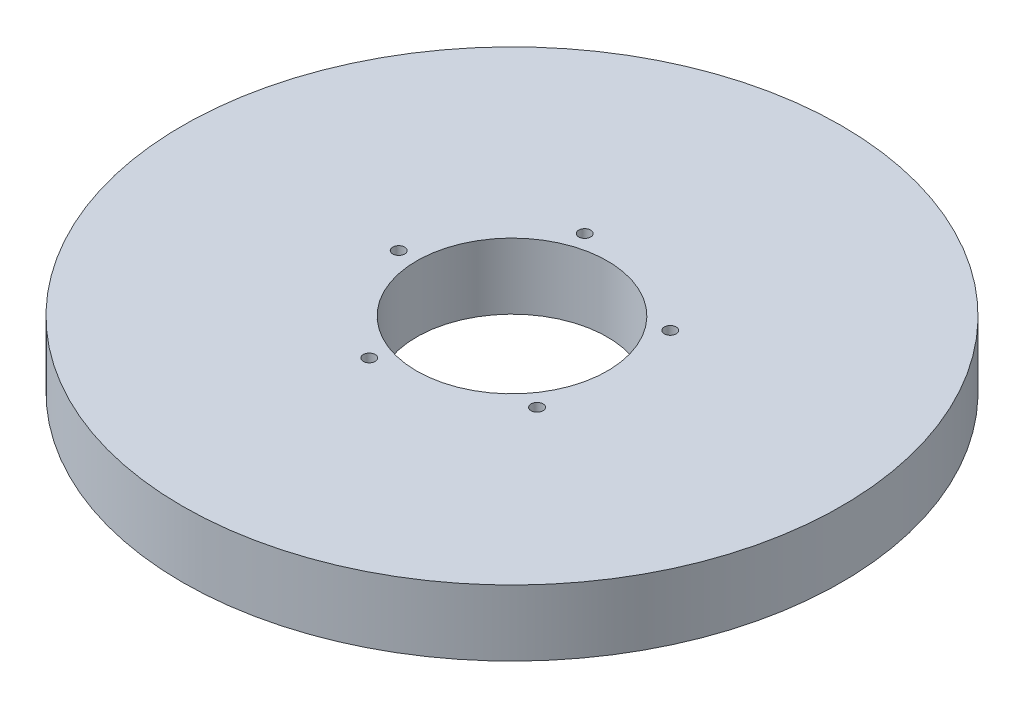
from build123d import *

# Parameters (mm, degrees)
SKETCH1_R           = 95
BOSS_EXTRUDE1_DEPTH = 19
SKETCH2_R           = 27.5
CUT_EXTRUDE1_DEPTH  = 136.687140142
SKETCH3_R           = 1.730453225
CUT_EXTRUDE2_DEPTH  = 14.244742321
CIRPATTERN1_COUNT   = 5


with BuildPart() as part:
    # Sketch1 → Boss-Extrude1 (new body)
    with BuildSketch(Plane(origin=(0, 0, 0), x_dir=(1, 0, 0), z_dir=(0, 1, 0))):
        Circle(SKETCH1_R)
    extrude(amount=BOSS_EXTRUDE1_DEPTH)

    # Sketch2 → Cut-Extrude1 (cut, through all)
    with BuildSketch(Plane(origin=(0, 0, 0), x_dir=(1, 0, 0), z_dir=(0, 1, 0))):
        Circle(SKETCH2_R)
    extrude(amount=CUT_EXTRUDE1_DEPTH, mode=Mode.SUBTRACT)

    # Sketch3 → Cut-Extrude2 (cut)
    with BuildSketch(Plane(origin=(0, 19, 0), x_dir=(1, 0, 0), z_dir=(0, 1, 0))):
        with Locations((-32.655618967, 0)):
            Circle(SKETCH3_R)
    cut_extrude2 = extrude(amount=-CUT_EXTRUDE2_DEPTH, mode=Mode.SUBTRACT)

    # CirPattern1: Cut-Extrude2 ×5 about axis
    cirpattern1_axis = Axis((0, 0, 0), (0, 1, 0))
    for i in range(1, CIRPATTERN1_COUNT):
        add(cut_extrude2.rotate(cirpattern1_axis, i * 360 / CIRPATTERN1_COUNT), mode=Mode.SUBTRACT)


solid = part.part
